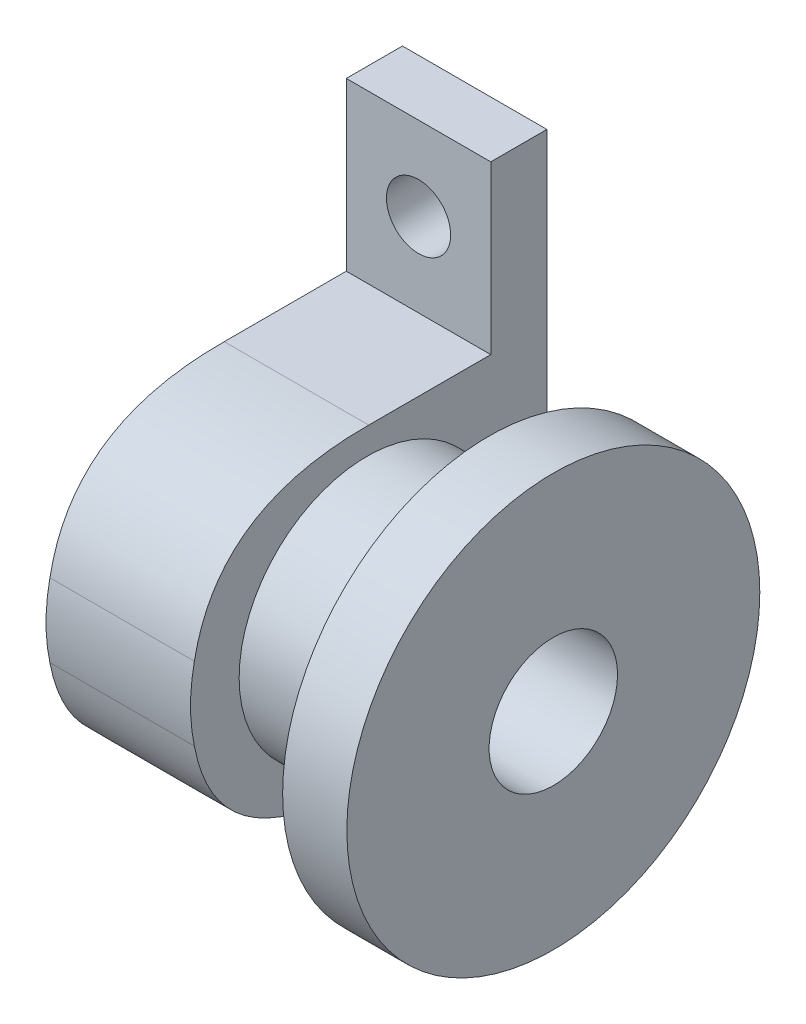
from build123d import *
from build123d.topology import SkipClean

# Parameters (mm, degrees)
SKETCH1_W           = 100
SKETCH1_H           = 22.5
BOSS_EXTRUDE1_DEPTH = 55.5
CUT_EXTRUDE1_DEPTH  = 79.016023995
SKETCH3_R           = 5
CUT_EXTRUDE2_DEPTH  = 73.059409747
SKETCH5_R           = 4.998437988
CUT_EXTRUDE3_DEPTH  = 73.059409747
SKETCH6_R           = 12
SKETCH6_R_2         = 10
BOSS_EXTRUDE2_DEPTH = 5
BOSS_EXTRUDE3_START = 19
SKETCH7_R           = 19.927383843
SKETCH7_R_2         = 10
BOSS_EXTRUDE3_DEPTH = 19
BOSS_EXTRUDE5_START = 10
SKETCH9_R           = 32.155692567
SKETCH9_R_2         = 10
BOSS_EXTRUDE5_DEPTH = 10


with BuildPart() as part:
    # Sketch1 → Boss-Extrude1 (new body)
    with BuildSketch(Plane(origin=(0, 0, 0), x_dir=(0, 1, 0), z_dir=(0, 0, 1))):
        with Locations((0, -11.25)):
            Rectangle(SKETCH1_W, SKETCH1_H)
    extrude(amount=BOSS_EXTRUDE1_DEPTH)

    # Sketch2 → Cut-Extrude1 (cut, through all)
    with BuildSketch(Plane.YZ.offset(22.5)):
        with BuildLine():
            Line((-50, 8.742021972), (-24, 8.742021972))
            Line((-24, 8.742021972), (-24, 14.574278418))
            ThreePointArc((-24, 14.574278418), (-27.5, 28), (-24, 41.425721582))
            Line((-24, 41.425721582), (-24, 55.5))
            Line((-24, 55.5), (-50, 55.5))
            Line((-50, 55.5), (-50, 8.742021972))
        make_face()
        with BuildLine():
            ThreePointArc((-24, 41.425721582), (-27.5, 28), (-24, 14.574278418))
            Line((-24, 14.574278418), (-24, 27.75))
            add(Edge.make_bspline(
                [(-24, 28.630883492), (-24.003292455, 28.193991063), (-24, 27.75)],
                knots=[0.983572463, 0.983572463, 0.983572463, 1, 1, 1], degree=2))
            Line((-24, 28.630883492), (-24, 41.425721582))
        make_face()
        with BuildLine():
            ThreePointArc((-15.102725788, 50.981681265), (-20.126720607, 46.73940014), (-24, 41.425721582))
            Line((-24, 41.425721582), (-24, 28.630883492))
            add(Edge.make_bspline(
                [(-15.102725788, 50.981681265), (-23.880610505, 44.473278164), (-24, 28.630883492)],
                knots=[0.387884574, 0.387884574, 0.387884574, 0.983572463, 0.983572463, 0.983572463], degree=2))
        make_face()
        with BuildLine():
            ThreePointArc((-24, 41.425721582), (-27.5, 28), (-24, 14.574278418))
            Line((-24, 14.574278418), (-24, 27.75))
            add(Edge.make_bspline(
                [(-24, 28.630883492), (-24.003292455, 28.193991063), (-24, 27.75)],
                knots=[0.983572463, 0.983572463, 0.983572463, 1, 1, 1], degree=2))
            Line((-24, 28.630883492), (-24, 41.425721582))
        make_face()
        with BuildLine():
            ThreePointArc((-15.102725788, 50.981681265), (-20.126720607, 46.73940014), (-24, 41.425721582))
            Line((-24, 41.425721582), (-24, 28.630883492))
            add(Edge.make_bspline(
                [(-15.102725788, 50.981681265), (-23.880610505, 44.473278164), (-24, 28.630883492)],
                knots=[0.387884574, 0.387884574, 0.387884574, 0.983572463, 0.983572463, 0.983572463], degree=2))
        make_face()
        with BuildLine():
            Line((-24, 55.5), (-24, 41.425721582))
            ThreePointArc((-24, 41.425721582), (-20.126720607, 46.73940014), (-15.102725788, 50.981681265))
            add(Edge.make_bspline(
                [(-5.719329936, 54.898685192), (-11.246534385, 53.840872164), (-15.102725788, 50.981681265)],
                knots=[0.126194361, 0.126194361, 0.126194361, 0.387884574, 0.387884574, 0.387884574], degree=2))
            ThreePointArc((-5.719329936, 54.898685192), (-2.875426682, 55.349258151), (0, 55.5))
            Line((0, 55.5), (-24, 55.5))
        make_face()
        with BuildLine():
            ThreePointArc((0, 38), (-10, 28), (0, 18))
            Line((0, 18), (0, 38))
        make_face()
        with BuildLine():
            Line((0, 38), (0, 18))
            ThreePointArc((0, 18), (7.071067812, 20.928932188), (10, 28))
            ThreePointArc((10, 28), (7.071067812, 35.071067812), (0, 38))
        make_face()
        with BuildLine():
            ThreePointArc((0, 38), (-10, 28), (0, 18))
            Line((0, 18), (0, 38))
        make_face()
        with BuildLine():
            Line((0, 38), (0, 18))
            ThreePointArc((0, 18), (7.071067812, 20.928932188), (10, 28))
            ThreePointArc((10, 28), (7.071067812, 35.071067812), (0, 38))
        make_face()
        with BuildLine():
            Line((24, 55.5), (0, 55.5))
            ThreePointArc((0, 55.5), (2.875426682, 55.349258151), (5.719329936, 54.898685192))
            add(Edge.make_bspline(
                [(5.719329936, 54.898685192), (11.246534385, 53.840872164), (15.102725788, 50.981681265)],
                knots=[0.126194361, 0.126194361, 0.126194361, 0.387884574, 0.387884574, 0.387884574], degree=2))
            ThreePointArc((15.102725788, 50.981681265), (20.126720607, 46.73940014), (24, 41.425721582))
            Line((24, 41.425721582), (24, 55.5))
        make_face()
        with BuildLine():
            Line((24, 14.574278418), (24, 8.742021972))
            Line((24, 8.742021972), (50, 8.742021972))
            Line((50, 8.742021972), (50, 14.574278418))
            Line((50, 14.574278418), (50, 55.5))
            Line((50, 55.5), (24, 55.5))
            Line((24, 55.5), (24, 41.425721582))
            ThreePointArc((24, 41.425721582), (26.610618181, 34.937218463), (27.5, 28))
            ThreePointArc((27.5, 28), (26.610618181, 21.062781537), (24, 14.574278418))
        make_face()
        with BuildLine():
            Line((24, 27.75), (24, 14.574278418))
            ThreePointArc((24, 14.574278418), (26.610618181, 21.062781537), (27.5, 28))
            ThreePointArc((27.5, 28), (26.610618181, 34.937218463), (24, 41.425721582))
            Line((24, 41.425721582), (24, 28.630883492))
            add(Edge.make_bspline(
                [(24, 28.630883492), (24.003292455, 28.193991063), (24, 27.75)],
                knots=[0.983572463, 0.983572463, 0.983572463, 1, 1, 1], degree=2))
        make_face()
        with BuildLine():
            ThreePointArc((24, 41.425721582), (20.126720607, 46.73940014), (15.102725788, 50.981681265))
            add(Edge.make_bspline(
                [(15.102725788, 50.981681265), (23.880610505, 44.473278164), (24, 28.630883492)],
                knots=[0.387884574, 0.387884574, 0.387884574, 0.983572463, 0.983572463, 0.983572463], degree=2))
            Line((24, 28.630883492), (24, 41.425721582))
        make_face()
        with BuildLine():
            Line((24, 27.75), (24, 14.574278418))
            ThreePointArc((24, 14.574278418), (26.610618181, 21.062781537), (27.5, 28))
            ThreePointArc((27.5, 28), (26.610618181, 34.937218463), (24, 41.425721582))
            Line((24, 41.425721582), (24, 28.630883492))
            add(Edge.make_bspline(
                [(24, 28.630883492), (24.003292455, 28.193991063), (24, 27.75)],
                knots=[0.983572463, 0.983572463, 0.983572463, 1, 1, 1], degree=2))
        make_face()
        with BuildLine():
            ThreePointArc((24, 41.425721582), (20.126720607, 46.73940014), (15.102725788, 50.981681265))
            add(Edge.make_bspline(
                [(15.102725788, 50.981681265), (23.880610505, 44.473278164), (24, 28.630883492)],
                knots=[0.387884574, 0.387884574, 0.387884574, 0.983572463, 0.983572463, 0.983572463], degree=2))
            Line((24, 28.630883492), (24, 41.425721582))
        make_face()
    extrude(amount=-CUT_EXTRUDE1_DEPTH, mode=Mode.SUBTRACT)

    # Sketch3 → Cut-Extrude2 (cut, through all)
    with BuildSketch(Plane.XY.offset(8.742021972)):
        with Locations((11.25, 37)):
            Circle(SKETCH3_R)
    extrude(amount=-CUT_EXTRUDE2_DEPTH, mode=Mode.SUBTRACT)

    # Sketch5 → Cut-Extrude3 (cut, through all)
    with BuildSketch(Plane.XY.offset(8.742021972)):
        with Locations((11.25, -37)):
            Circle(SKETCH5_R)
    extrude(amount=-CUT_EXTRUDE3_DEPTH, mode=Mode.SUBTRACT)

    # Sketch6 → Boss-Extrude2 (add)
    with SkipClean():  # the faces are left unmerged after this step: merging them gives an invalid solid
        with BuildSketch(Plane(origin=(0, 0, 0), x_dir=(0, -1, 0), z_dir=(-1, 0, 0))):
            with Locations((0, 28)):
                Circle(SKETCH6_R)
            with Locations((0, 28)):
                Circle(SKETCH6_R_2, mode=Mode.SUBTRACT)
        extrude(amount=BOSS_EXTRUDE2_DEPTH)

    # Sketch7 → Boss-Extrude3 (add)
    with SkipClean():  # the faces are left unmerged after this step: merging them gives an invalid solid
        with BuildSketch(Plane.YZ.offset(22.5).offset(BOSS_EXTRUDE3_START)):
            with Locations((0, 28)):
                Circle(SKETCH7_R)
            with Locations((0, 28)):
                Circle(SKETCH7_R_2, mode=Mode.SUBTRACT)
        extrude(amount=-BOSS_EXTRUDE3_DEPTH)

    # Sketch9 → Boss-Extrude5 (add)
    with SkipClean():  # the faces are left unmerged after this step: merging them gives an invalid solid
        with BuildSketch(Plane.YZ.offset(41.5).offset(BOSS_EXTRUDE5_START)):
            with Locations((0, 28)):
                Circle(SKETCH9_R)
            with Locations((0, 28)):
                Circle(SKETCH9_R_2, mode=Mode.SUBTRACT)
        extrude(amount=-BOSS_EXTRUDE5_DEPTH)


with BuildPart() as body_2:
    # Split1: the piece on the far side of the plane
    add(part.part)
    split(bisect_by=Plane(origin=(22.5, -50, 55.5), x_dir=(0, 0, -1), z_dir=(-1, 0, 0)), keep=Keep.BOTTOM)


with BuildPart() as part_1:
    add(part.part)

    # Split1
    split(bisect_by=Plane(origin=(22.5, -50, 55.5), x_dir=(0, 0, -1), z_dir=(-1, 0, 0)), keep=Keep.TOP)


solid = Compound([body_2.part, part_1.part])
